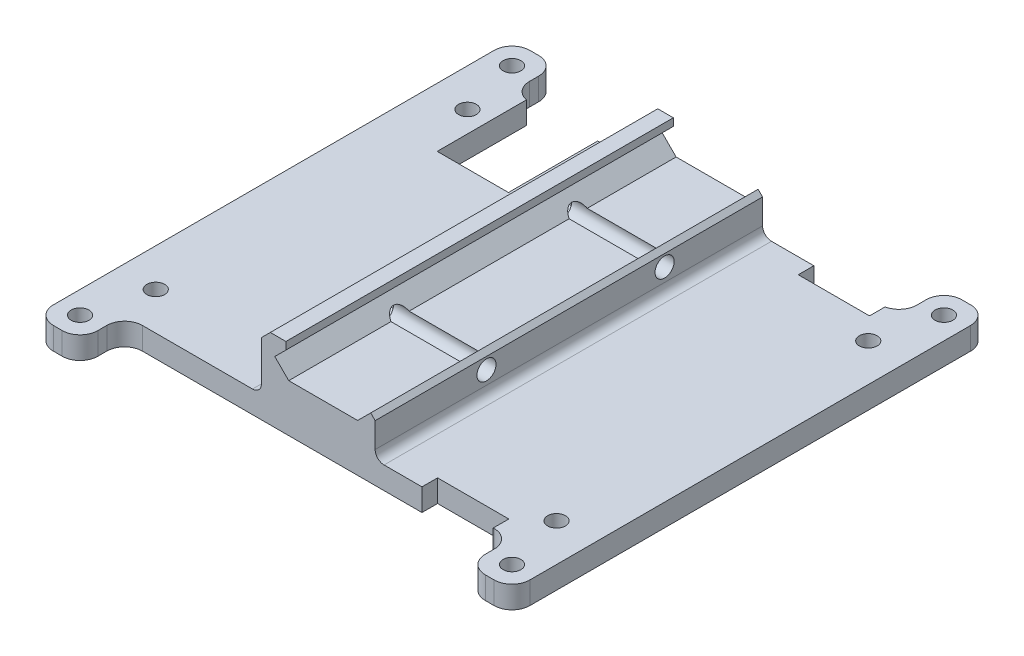
from build123d import *

# Parameters (mm, degrees)
BOSS_EXTRUDE1_DEPTH             = 87
CUT_EXTRUDE2_REACH              = 112.235
SKETCH7_R                       = 2.15
CUT_EXTRUDE3_DEPTH              = 2.5
F_4_0_START                     = -13.82
F_4_0_MM_DOWEL_HOLES1_OUTLINE_R = 2
F_4_0_MM_DOWEL_HOLES1_DEPTH     = 5.82
SKETCH11_W                      = 16
SKETCH11_H                      = 20.05000263
SKETCH11_H_2                    = 3.5
CUT_EXTRUDE4_DEPTH              = 10
SKETCH12_W                      = 10
SKETCH12_H                      = 10
SKETCH12_R                      = 2
BOSS_EXTRUDE2_DEPTH             = 5
MIRROR2_COPY_1_SKETCH_W         = 10
MIRROR2_COPY_1_SKETCH_H         = 10
MIRROR2_COPY_1_SKETCH_R         = 2
MIRROR2_COPY_1_DEPTH            = 5
FILLET1_R                       = 4
FILLET2_R                       = 2
CHAMFER1_SIZE                   = 2


with BuildPart() as part:
    # Sketch1 → Boss-Extrude1 (new body)
    with BuildSketch(Plane.XY):
        Polygon((0, 0), (2.5, 2.5), (2.5, 4.18), (-3, 4.18), (-3, -8.82), (-43.73, -8.82), (-43.73, -13.82), (63.27, -13.82), (63.27, -8.82), (22.54, -8.82), (22.54, -1.2), (21.54, -0.2), (18.61, -3.13), (3.13, -3.13), align=None)
    extrude(amount=BOSS_EXTRUDE1_DEPTH)

    # Sketch7 → Cut-Extrude2 (cut, up to next)
    with BuildSketch(Plane(origin=(22.54, 0, 0), x_dir=(0, 0, -1), z_dir=(1, 0, 0)), mode=Mode.PRIVATE) as cut_extrude2_sk1:
        with Locations(Location((-62, -3.82, 0), (0, 0, 90))):
            Circle(SKETCH7_R)
    cut_extrude2_tool1 = extrude(cut_extrude2_sk1.sketch, amount=-CUT_EXTRUDE2_REACH, mode=Mode.PRIVATE) & part.part
    # Sketch7 → Cut-Extrude2 (cut, up to next)
    with BuildSketch(Plane(origin=(22.54, 0, 0), x_dir=(0, 0, -1), z_dir=(1, 0, 0)), mode=Mode.PRIVATE) as cut_extrude2_sk2:
        with Locations(Location((-22, -3.82, 0), (0, 0, 90))):
            Circle(SKETCH7_R)
    cut_extrude2_tool2 = extrude(cut_extrude2_sk2.sketch, amount=-CUT_EXTRUDE2_REACH, mode=Mode.PRIVATE) & part.part
    add(cut_extrude2_tool1.solids().sort_by_distance((22.54, -3.82, 62))[0], mode=Mode.SUBTRACT)
    add(cut_extrude2_tool2.solids().sort_by_distance((22.54, -3.82, 22))[0], mode=Mode.SUBTRACT)

    # Sketch8 → Cut-Extrude3 (cut)
    with BuildSketch(Plane.ZY.offset(3)):
        Polygon((25.45, -5.811858429), (25.45, -1.828141571), (22, 0.163716857), (18.55, -1.828141571), (18.55, -5.811858429), (22, -7.803716857), align=None)
        Polygon((65.45, -5.811858429), (65.45, -1.828141571), (62, 0.163716857), (58.55, -1.828141571), (58.55, -5.811858429), (62, -7.803716857), align=None)
    extrude(amount=-CUT_EXTRUDE3_DEPTH, mode=Mode.SUBTRACT)

    # Ø4.0 mm Dowel Holes1: read off the stored shape, not the designer's step
    # Ø4.0 mm Dowel Holes1 outline → Ø4.0 mm Dowel Holes1 (cut)
    with BuildSketch(Plane(origin=(0, 0, 0), x_dir=(1, 0, 0), z_dir=(0, 1, 0)).offset(F_4_0_START)):
        with Locations((54.77, -78.5)):
            Circle(F_4_0_MM_DOWEL_HOLES1_OUTLINE_R)
        with Locations((-35.23, -8.5)):
            Circle(F_4_0_MM_DOWEL_HOLES1_OUTLINE_R)
        with Locations((54.77, -8.5)):
            Circle(F_4_0_MM_DOWEL_HOLES1_OUTLINE_R)
        with Locations((-35.23, -78.5)):
            Circle(F_4_0_MM_DOWEL_HOLES1_OUTLINE_R)
    extrude(amount=F_4_0_MM_DOWEL_HOLES1_DEPTH, mode=Mode.SUBTRACT)

    # Sketch11 → Cut-Extrude4 (cut)
    with BuildSketch(Plane.XZ.offset(13.82)):
        with Locations((-22.479997093, 10.025001315)):
            Rectangle(SKETCH11_W, SKETCH11_H)
        with Locations((42.054998939, 1.75)):
            Rectangle(SKETCH11_W, SKETCH11_H_2)
        with Locations((41.054998153, 85.25)):
            Rectangle(SKETCH11_W, SKETCH11_H_2)
    extrude(amount=-CUT_EXTRUDE4_DEPTH, mode=Mode.SUBTRACT)

    # Sketch12 → Boss-Extrude2 (add)
    with BuildSketch(Plane.XZ.offset(13.82)):
        with Locations((-38.73, -5)):
            Rectangle(SKETCH12_W, SKETCH12_H)
        with Locations(Location((-38.73, -5, 0), (0, 0, 270))):
            Circle(SKETCH12_R, mode=Mode.SUBTRACT)
    boss_extrude2 = extrude(amount=-BOSS_EXTRUDE2_DEPTH)

    # Mirror1: Boss-Extrude2 across plane
    add(boss_extrude2.mirror(Plane.XY.offset(43.5)))

    # Mirror2: Boss-Extrude2 across plane
    add(boss_extrude2.mirror(Plane.ZY.offset(-9.77)))

    # Mirror2 copy 1 sketch → Mirror2 copy 1 (add)
    with BuildSketch(Plane(origin=(19.54, -13.82, 87), x_dir=(-1, 0, 0), z_dir=(0, -1, 0))):
        with Locations((-38.73, -5)):
            Rectangle(MIRROR2_COPY_1_SKETCH_W, MIRROR2_COPY_1_SKETCH_H)
        with Locations(Location((-38.73, -5, 0), (0, 0, 270))):
            Circle(MIRROR2_COPY_1_SKETCH_R, mode=Mode.SUBTRACT)
    extrude(amount=-MIRROR2_COPY_1_DEPTH)

    # Fillet1
    # the kernel refuses this fillet: 4 mm, written as the material it adds along each edge
    with BuildSketch(Plane(origin=(-33.73, -13.82, 87), x_dir=(1, 0, 0), z_dir=(0, 1, 0)), Plane(origin=(53.27, -13.82, 87), x_dir=(0, 0, 1), z_dir=(0, 1, 0))) as fillet1_piece_1:
        with BuildLine():
            CenterArc((FILLET1_R, -FILLET1_R), FILLET1_R, 90, 90)
            Line((0, -FILLET1_R), (0, 0))
            Line((0, 0), (FILLET1_R, 0))
        make_face()
    extrude(amount=5)
    with BuildSketch(Plane(origin=(-33.73, -13.82, 0), x_dir=(1, 0, 0), z_dir=(0, 1, 0))) as fillet1_piece_2:
        with BuildLine():
            CenterArc((4, 3.929058966), FILLET1_R, 180, 79.193119511)
            Line((0, 3.929058966), (0, 0))
            Line((0, 0), (3.250002907, 0))
        make_face()
    extrude(amount=5)
    with BuildSketch(Plane(origin=(53.27, -13.82, 0), x_dir=(-1.0, -2.775557561562891e-15, -1.2049110107124816e-12), z_dir=(0, 1, 0))) as fillet1_piece_3:
        with BuildLine():
            CenterArc((4, -3.922215785), FILLET1_R, 101.317738871, 78.682261129)
            Line((0, -3.922215785), (0, 0))
            Line((0, 0), (3.215001061, 0))
        make_face()
    extrude(amount=5)
    # the kernel refuses this fillet: 4 mm, written as the material it takes off along each edge
    with BuildSketch(Plane(origin=(-33.73, -23.82, 97), x_dir=(-1, 0, 0), z_dir=(0, 1, 0)), Plane(origin=(-43.73, -23.82, 97), x_dir=(0, 0, -1), z_dir=(0, 1, 0)), Plane(origin=(-43.73, -23.82, -10), x_dir=(1, 0, 0), z_dir=(0, 1, 0)), Plane(origin=(-33.73, -23.82, -10), x_dir=(0, 0, 1), z_dir=(0, 1, 0))) as fillet1_2_piece_1:
        with BuildLine():
            CenterArc((FILLET1_R, -FILLET1_R), FILLET1_R, 90, 90)
            Line((0, -FILLET1_R), (0, 0))
            Line((0, 0), (FILLET1_R, 0))
        make_face()
    extrude(amount=25, mode=Mode.SUBTRACT)
    with BuildSketch(Plane(origin=(53.27, -23.82, -10), x_dir=(0, 0, 1), z_dir=(0, 1, 0)), Plane(origin=(53.27, -23.82, 97), x_dir=(1, 0, 0), z_dir=(0, 1, 0)), Plane(origin=(63.27, -23.82, 97), x_dir=(0, 0, -1), z_dir=(0, 1, 0)), Plane(origin=(63.27, -23.82, -10), x_dir=(-1, 0, 0), z_dir=(0, 1, 0))) as fillet1_2_piece_2:
        with BuildLine():
            CenterArc((FILLET1_R, FILLET1_R), FILLET1_R, 180, 90)
            Line((0, FILLET1_R), (0, 0))
            Line((0, 0), (FILLET1_R, 0))
        make_face()
    extrude(amount=25, mode=Mode.SUBTRACT)

    # Fillet2
    # the kernel refuses this fillet: 2 mm, written as the material it adds along each edge
    with BuildSketch(Plane(origin=(22.54, -8.82, 0), x_dir=(1, 0, 0), z_dir=(0, 0, 1))) as fillet2_piece_1:
        with BuildLine():
            CenterArc((FILLET2_R, FILLET2_R), FILLET2_R, 180, 90)
            Line((0, FILLET2_R), (0, 0))
            Line((0, 0), (FILLET2_R, 0))
        make_face()
    extrude(amount=87)
    with BuildSketch(Plane(origin=(-3, -8.82, 0), x_dir=(-1, 0, 0), z_dir=(0, 0, 1))) as fillet2_piece_2_section:
        with BuildLine():
            CenterArc((FILLET2_R, -FILLET2_R), FILLET2_R, 90, 90)
            Line((0, -FILLET2_R), (0, 0))
            Line((0, 0), (FILLET2_R, 0))
        make_face()
    fillet2_piece_2 = extrude(amount=87, mode=Mode.PRIVATE)
    fillet2_piece_2 = split(fillet2_piece_2, bisect_by=Plane(origin=(-3, -17.584067085, 5.059936491), z_dir=(0, 0.8660254037844386, -0.5000000000000001)), keep=Keep.TOP, mode=Mode.PRIVATE)
    fillet2_piece_2 = split(fillet2_piece_2, bisect_by=Plane(origin=(-3, 1.468491799, 5.940063509), z_dir=(0, -0.8660254037844385, -0.5000000000000003)), keep=Keep.TOP, mode=Mode.PRIVATE)
    add(fillet2_piece_2)
    with BuildSketch(Plane(origin=(-3, -8.82, 0), x_dir=(-1, 0, 0), z_dir=(0, 0, 1))) as fillet2_piece_3_section:
        with BuildLine():
            CenterArc((FILLET2_R, -FILLET2_R), FILLET2_R, 90, 90)
            Line((0, -FILLET2_R), (0, 0))
            Line((0, 0), (FILLET2_R, 0))
        make_face()
    fillet2_piece_3 = extrude(amount=87, mode=Mode.PRIVATE)
    fillet2_piece_3 = split(fillet2_piece_3, bisect_by=Plane(origin=(-3, -17.584067085, 5.059936491), z_dir=(0, -0.8660254037844386, 0.5000000000000001)), keep=Keep.TOP, mode=Mode.PRIVATE)
    fillet2_piece_3 = split(fillet2_piece_3, bisect_by=Plane(origin=(-3, 1.468491799, 5.940063509), z_dir=(0, -0.8660254037844385, -0.5000000000000003)), keep=Keep.TOP, mode=Mode.PRIVATE)
    add(fillet2_piece_3)
    with BuildSketch(Plane(origin=(-3, -8.82, 0), x_dir=(-1, 0, 0), z_dir=(0, 0, 1))) as fillet2_piece_4_section:
        with BuildLine():
            CenterArc((FILLET2_R, -FILLET2_R), FILLET2_R, 90, 90)
            Line((0, -FILLET2_R), (0, 0))
            Line((0, 0), (FILLET2_R, 0))
        make_face()
    fillet2_piece_4 = extrude(amount=87, mode=Mode.PRIVATE)
    fillet2_piece_4 = split(fillet2_piece_4, bisect_by=Plane(origin=(-3, -34.90457516, 15.059936491), z_dir=(0, 0.8660254037844385, -0.5000000000000003)), keep=Keep.TOP, mode=Mode.PRIVATE)
    fillet2_piece_4 = split(fillet2_piece_4, bisect_by=Plane(origin=(-3, 18.788999874, 15.940063509), z_dir=(0, -0.8660254037844385, -0.5000000000000003)), keep=Keep.TOP, mode=Mode.PRIVATE)
    fillet2_piece_4 = split(fillet2_piece_4, bisect_by=Plane(origin=(-3, -17.584067085, 5.059936491), z_dir=(0, -0.8660254037844386, 0.5000000000000001)), keep=Keep.TOP, mode=Mode.PRIVATE)
    fillet2_piece_4 = split(fillet2_piece_4, bisect_by=Plane(origin=(-3, 1.468491799, 5.940063509), z_dir=(0, 0.8660254037844385, 0.5000000000000003)), keep=Keep.TOP, mode=Mode.PRIVATE)
    add(fillet2_piece_4)
    with BuildSketch(Plane(origin=(-3, -8.82, 0), x_dir=(-1, 0, 0), z_dir=(0, 0, 1))) as fillet2_piece_5_section:
        with BuildLine():
            CenterArc((FILLET2_R, -FILLET2_R), FILLET2_R, 90, 90)
            Line((0, -FILLET2_R), (0, 0))
            Line((0, 0), (FILLET2_R, 0))
        make_face()
    fillet2_piece_5 = extrude(amount=87, mode=Mode.PRIVATE)
    fillet2_piece_5 = split(fillet2_piece_5, bisect_by=Plane(origin=(-3, -34.90457516, 15.059936491), z_dir=(0, -0.8660254037844385, 0.5000000000000003)), keep=Keep.TOP, mode=Mode.PRIVATE)
    fillet2_piece_5 = split(fillet2_piece_5, bisect_by=Plane(origin=(-3, 18.788999874, 15.940063509), z_dir=(0, -0.8660254037844385, -0.5000000000000003)), keep=Keep.TOP, mode=Mode.PRIVATE)
    add(fillet2_piece_5)
    with BuildSketch(Plane(origin=(-3, -8.82, 0), x_dir=(-1, 0, 0), z_dir=(0, 0, 1))) as fillet2_piece_6_section:
        with BuildLine():
            CenterArc((FILLET2_R, -FILLET2_R), FILLET2_R, 90, 90)
            Line((0, -FILLET2_R), (0, 0))
            Line((0, 0), (FILLET2_R, 0))
        make_face()
    fillet2_piece_6 = extrude(amount=87, mode=Mode.PRIVATE)
    fillet2_piece_6 = split(fillet2_piece_6, bisect_by=Plane(origin=(-3, -34.90457516, 15.059936491), z_dir=(0, -0.8660254037844385, 0.5000000000000003)), keep=Keep.TOP, mode=Mode.PRIVATE)
    fillet2_piece_6 = split(fillet2_piece_6, bisect_by=Plane(origin=(-3, 18.788999874, 15.940063509), z_dir=(0, 0.8660254037844385, 0.5000000000000003)), keep=Keep.TOP, mode=Mode.PRIVATE)
    add(fillet2_piece_6)

    # Chamfer1
    chamfer1_edges = [part.edges().sort_by_distance(p)[0] for p in [
        (-3, 4.18, 43.5),
    ]]
    chamfer(chamfer1_edges, length=CHAMFER1_SIZE)


solid = part.part
